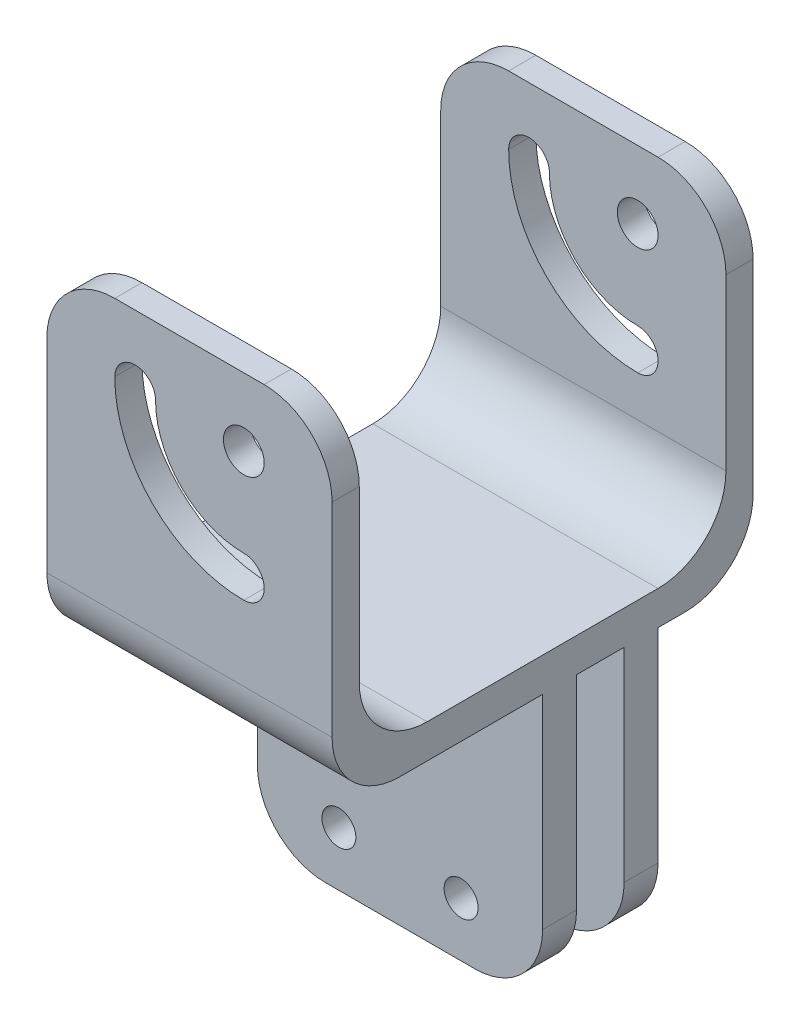
from build123d import *

# Parameters (mm, degrees)
ESBO_O1_W                = 42
ESBO_O1_H                = 50
ESBO_O1_R                = 3
RESSALTO_EXTRUS_O2_DEPTH = 62
ESBO_O3_W                = 42
ESBO_O3_H                = 54
CORTE_EXTRUS_O1_DEPTH    = 45
ESBO_O7_W                = 42
ESBO_O7_H                = 5
RESSALTO_EXTRUS_O3_DEPTH = 40
ESBO_O10_R               = 2.5
CORTE_EXTRUS_O2_DEPTH    = 82.043198357
FILETE1_R                = 10


with BuildPart() as part:
    # Esboço1 → Ressalto-extrusão2 (new body)
    with BuildSketch(Plane.XY):
        with Locations((21, 25)):
            Rectangle(ESBO_O1_W, ESBO_O1_H)
        with Locations((29, 40)):
            Circle(ESBO_O1_R, mode=Mode.SUBTRACT)
        with BuildLine():
            ThreePointArc((10, 40), (15.564971157, 26.564971157), (29, 21))
            ThreePointArc((29, 21), (32, 24), (29, 27))
            ThreePointArc((29, 27), (19.807611845, 30.807611845), (16, 40))
            ThreePointArc((16, 40), (13, 43), (10, 40))
        make_face(mode=Mode.SUBTRACT)
    extrude(amount=RESSALTO_EXTRUS_O2_DEPTH)

    # Esboço3 → Corte-extrusão1 (cut)
    with BuildSketch(Plane(origin=(0, 50, 0), x_dir=(1, 0, 0), z_dir=(0, 1, 0))):
        with Locations((21, -31)):
            Rectangle(ESBO_O3_W, ESBO_O3_H)
    extrude(amount=-CORTE_EXTRUS_O1_DEPTH, mode=Mode.SUBTRACT)

    # Esboço7 → Ressalto-extrusão3 (add)
    with BuildSketch(Plane.XZ):
        with Locations((21, 16.5)):
            Rectangle(ESBO_O7_W, ESBO_O7_H)
        with Locations((21, 28.5)):
            Rectangle(ESBO_O7_W, ESBO_O7_H)
    extrude(amount=RESSALTO_EXTRUS_O3_DEPTH)

    # Esboço10 → Corte-extrusão2 (cut, through all)
    with BuildSketch(Plane(origin=(0, 0, 14), x_dir=(-1, 0, 0), z_dir=(0, 0, -1))):
        with Locations((-30, -32)):
            Circle(ESBO_O10_R)
        with Locations((-12, -32)):
            Circle(ESBO_O10_R)
    extrude(amount=-CORTE_EXTRUS_O2_DEPTH, mode=Mode.SUBTRACT)

    # Filete1
    filete1_edges = [part.edges().sort_by_distance(p)[0] for p in [
        (21, 5, 4),
        (0, 50, 2),
        (42, 50, 2),
        (21, 5, 58),
        (21, 0, 62),
        (21, 0, 0),
        (42, -40, 28.5),
        (42, -40, 16.5),
        (0, -40, 16.5),
        (0, -40, 28.5),
        (0, 50, 60),
        (42, 50, 60),
    ]]
    fillet(filete1_edges, radius=FILETE1_R)


solid = part.part
